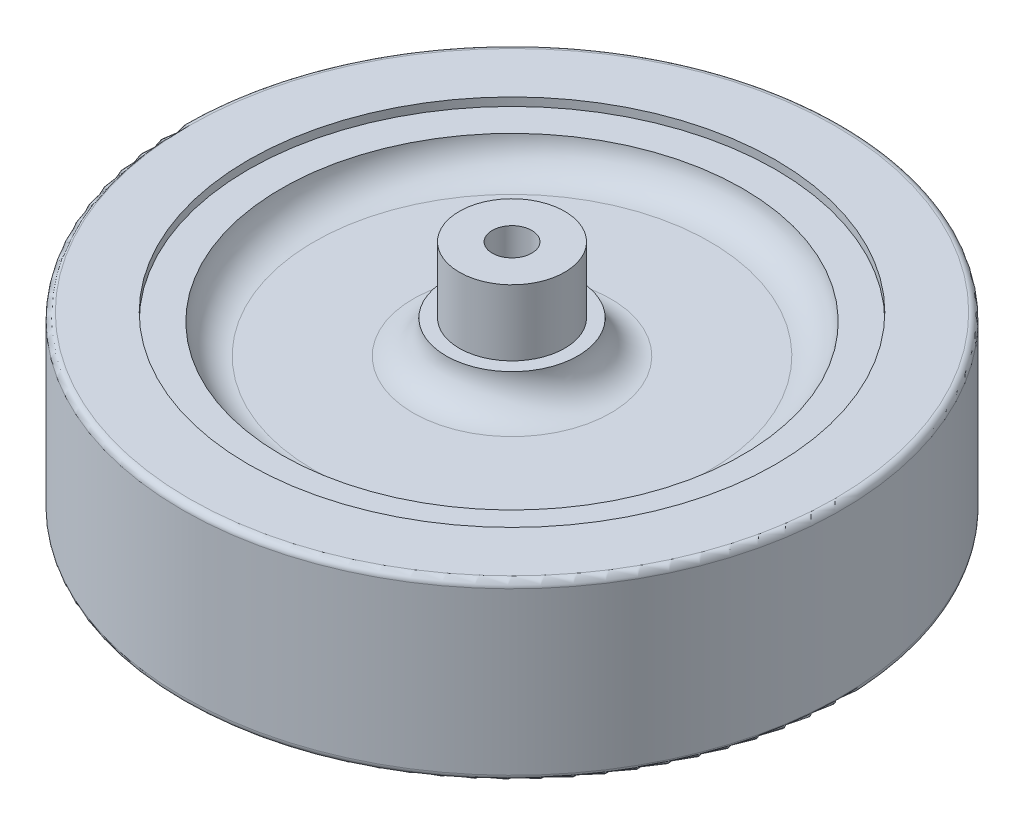
from build123d import *

# Parameters (mm, degrees)
SKETCH1_R           = 50
SKETCH1_R_2         = 40
BOSS_EXTRUDE1_DEPTH = 13.25
SKETCH2_R           = 40
SKETCH2_R_2         = 35
BOSS_EXTRUDE2_DEPTH = 12
SKETCH4_R           = 35
SKETCH4_R_2         = 10
BOSS_EXTRUDE3_DEPTH = 7.5
SKETCH7_R           = 10
BOSS_EXTRUDE4_DEPTH = 12.5
FILLET1_R           = 5
SKETCH10_R          = 8
BOSS_EXTRUDE5_DEPTH = 10
SKETCH11_R          = 3
CUT_EXTRUDE2_DEPTH  = 76.253322186
FILLET2_R           = 1


with BuildPart() as part:
    # Sketch1 → Boss-Extrude1 (new, symmetric)
    with BuildSketch(Plane(origin=(0, 0, 0), x_dir=(1, 0, 0), z_dir=(0, 1, 0))):
        with Locations(Location((0, 0, 0), (0, 0, 270))):
            Circle(SKETCH1_R)
        with Locations(Location((0, 0, 0), (0, 0, 270))):
            Circle(SKETCH1_R_2, mode=Mode.SUBTRACT)
    extrude(amount=BOSS_EXTRUDE1_DEPTH, both=True)

    # Sketch2 → Boss-Extrude2 (add, symmetric)
    with BuildSketch(Plane(origin=(0, 0, 0), x_dir=(1, 0, 0), z_dir=(0, 1, 0))):
        with Locations(Location((0, 0, 0), (0, 0, 270))):
            Circle(SKETCH2_R)
        with Locations(Location((0, 0, 0), (0, 0, 270))):
            Circle(SKETCH2_R_2, mode=Mode.SUBTRACT)
    extrude(amount=BOSS_EXTRUDE2_DEPTH, both=True)

    # Sketch4 → Boss-Extrude3 (add, symmetric)
    with BuildSketch(Plane(origin=(0, 0, 0), x_dir=(1, 0, 0), z_dir=(0, 1, 0))):
        with Locations(Location((0, 0, 0), (0, 0, 270))):
            Circle(SKETCH4_R)
        with Locations(Location((0, 0, 0), (0, 0, 270))):
            Circle(SKETCH4_R_2, mode=Mode.SUBTRACT)
    extrude(amount=BOSS_EXTRUDE3_DEPTH, both=True)

    # Sketch7 → Boss-Extrude4 (add, symmetric)
    with BuildSketch(Plane(origin=(0, 0, 0), x_dir=(1, 0, 0), z_dir=(0, 1, 0))):
        with Locations(Location((0, 0, 0), (0, 0, 270))):
            Circle(SKETCH7_R)
    extrude(amount=BOSS_EXTRUDE4_DEPTH, both=True)

    # Fillet1
    # the kernel refuses this fillet: 5 mm, written as the material it adds along each edge
    with BuildSketch(Plane(origin=(0, 7.5, 0), x_dir=(0, 0, 1), z_dir=(-1, 0, 0))) as fillet1_piece_1:
        with BuildLine():
            CenterArc((30.025062814, 5), FILLET1_R, 270, 84.260829523)
            Line((30.025062814, 0), (30.025062814, -0.1))
            Line((30.025062814, -0.1), (35, -0.1))
            Line((35, -0.1), (35.1, 0))
            ThreePointArc((35.1, 0), (35.1, 2.25), (35.099498744, 4.49))
            Line((35.099498744, 4.49), (35, 4.5))
        make_face()
    revolve(axis=Axis((0, 7.5, 0), (0, 1, 0)))
    with BuildSketch(Plane(origin=(0, -7.5, 0), x_dir=(0, 0, 1), z_dir=(-1, 0, 0))) as fillet1_piece_2:
        with BuildLine():
            CenterArc((30.025062814, -5), FILLET1_R, 5.739170477, 84.260829523)
            Line((35, -4.5), (35.099498744, -4.49))
            ThreePointArc((35.099498744, -4.49), (35.1, -2.25), (35.1, 0))
            Line((35.1, 0), (35, 0.1))
            Line((35, 0.1), (30.025062814, 0.1))
            Line((30.025062814, 0.1), (30.025062814, 0))
        make_face()
    revolve(axis=Axis((0, -7.5, 0), (0, 1, 0)))
    with BuildSketch(Plane(origin=(0, 7.5, 0), x_dir=(0, 0, 1), z_dir=(-1, 0, 0))) as fillet1_piece_3:
        with BuildLine():
            CenterArc((10 + FILLET1_R, FILLET1_R), FILLET1_R, 180, 90)
            Line((10, FILLET1_R), (10 - FILLET1_R * 0.02, FILLET1_R))
            Line((10 - FILLET1_R * 0.02, FILLET1_R), (10 - FILLET1_R * 0.02, -FILLET1_R * 0.02))
            Line((10 - FILLET1_R * 0.02, -FILLET1_R * 0.02), (10 + FILLET1_R, -FILLET1_R * 0.02))
            Line((10 + FILLET1_R, -FILLET1_R * 0.02), (10 + FILLET1_R, 0))
        make_face()
    revolve(axis=Axis((0, 7.5, 0), (0, 1, 0)))
    with BuildSketch(Plane(origin=(0, -7.5, 0), x_dir=(0, 0, 1), z_dir=(-1, 0, 0))) as fillet1_piece_4:
        with BuildLine():
            CenterArc((10 + FILLET1_R, -FILLET1_R), FILLET1_R, 90, 90)
            Line((10 + FILLET1_R, 0), (10 + FILLET1_R, FILLET1_R * 0.02))
            Line((10 + FILLET1_R, FILLET1_R * 0.02), (10 - FILLET1_R * 0.02, FILLET1_R * 0.02))
            Line((10 - FILLET1_R * 0.02, FILLET1_R * 0.02), (10 - FILLET1_R * 0.02, -FILLET1_R))
            Line((10 - FILLET1_R * 0.02, -FILLET1_R), (10, -FILLET1_R))
        make_face()
    revolve(axis=Axis((0, -7.5, 0), (0, 1, 0)))

    # Sketch10 → Boss-Extrude5 (add)
    with BuildSketch(Plane(origin=(0, 12.5, 0), x_dir=(1, 0, 0), z_dir=(0, 1, 0))):
        with Locations(Location((0, 0, 0), (0, 0, 270))):
            Circle(SKETCH10_R)
    extrude(amount=BOSS_EXTRUDE5_DEPTH)

    # Sketch11 → Cut-Extrude2 (cut, through all)
    with BuildSketch(Plane(origin=(0, 12.5, 0), x_dir=(1, 0, 0), z_dir=(0, 1, 0))):
        with Locations(Location((0, 0, 0), (0, 0, 270))):
            Circle(SKETCH11_R)
    extrude(amount=CUT_EXTRUDE2_DEPTH, mode=Mode.SUBTRACT)

    # Fillet2
    fillet2_edges = [part.edges().sort_by_distance(p)[0] for p in [
        (0, -13.25, -50),
        (0, 13.25, -50),
    ]]
    fillet(fillet2_edges, radius=FILLET2_R)


solid = part.part
